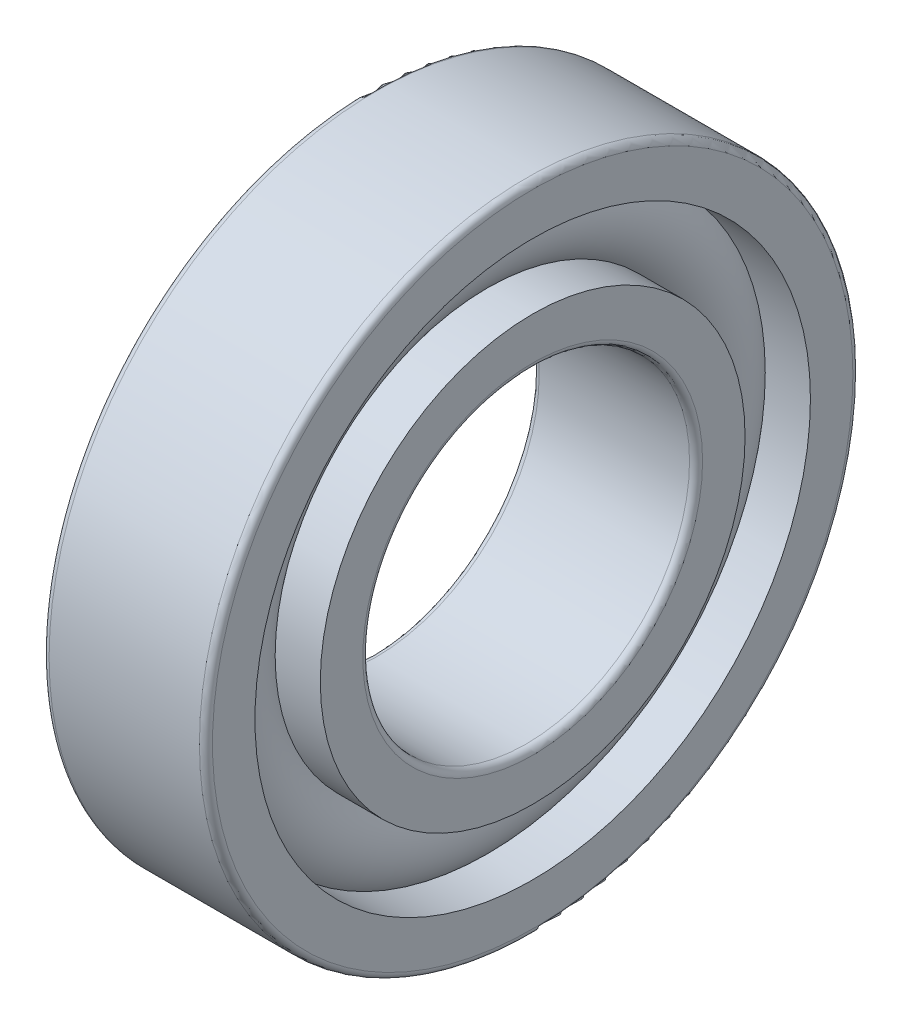
from build123d import *

# Parameters (mm, degrees)
CAGSPISKE_W     = 0.1905
CAGSPISKE_H     = 0.3175
CAGESPINE_ANGLE = 0.001
BALSIMSKE_R     = 0.9525


with BuildPart() as part:
    # CagSpiSke → CageSpine (revolve)
    with BuildSketch(Plane.XY):
        with Locations((0, 4.7625)):
            Rectangle(CAGSPISKE_W, CAGSPISKE_H)
    revolve(axis=Axis((-20.6375, 0, 0), (-1, 0, 0)), revolution_arc=CAGESPINE_ANGLE)

    # BalSimSke → BallsSimplified (revolve)
    with BuildSketch(Plane.XY):
        with Locations((0, 4.7625)):
            Circle(BALSIMSKE_R)
    revolve(axis=Axis((-10, 0, 0), (1, 0, 0)))

    # InnRacSke → InnerRace (revolve)
    with BuildSketch(Plane.XY):
        with BuildLine():
            Line((-0.650091976, 4.1275), (-1.5875, 4.1275))
            Line((-1.5875, 4.1275), (-1.5875, 3.302))
            ThreePointArc((-1.5875, 3.302), (-1.550302561, 3.212197439), (-1.4605, 3.175))
            Line((-1.4605, 3.175), (1.4605, 3.175))
            ThreePointArc((1.4605, 3.175), (1.550302561, 3.212197439), (1.5875, 3.302))
            Line((1.5875, 3.302), (1.5875, 4.1275))
            Line((1.5875, 4.1275), (0.700891976, 4.1275))
            ThreePointArc((0.700891976, 4.1275), (0.0254, 3.8354), (-0.650091976, 4.1275))
        make_face()
    revolve(axis=Axis((-20.6375, 0, 0), (1, 0, 0)))

    # OutRacSke → OuterRace (revolve)
    with BuildSketch(Plane.XY):
        with BuildLine():
            Line((-0.675491976, 5.3975), (-1.5875, 5.3975))
            Line((-1.5875, 5.3975), (-1.5875, 6.223))
            ThreePointArc((-1.5875, 6.223), (-1.550302561, 6.312802561), (-1.4605, 6.35))
            Line((-1.4605, 6.35), (1.4605, 6.35))
            ThreePointArc((1.4605, 6.35), (1.550302561, 6.312802561), (1.5875, 6.223))
            Line((1.5875, 6.223), (1.5875, 5.3975))
            Line((1.5875, 5.3975), (0.675491976, 5.3975))
            ThreePointArc((0.675491976, 5.3975), (0, 5.6896), (-0.675491976, 5.3975))
        make_face()
    revolve(axis=Axis((-20.6375, 0, 0), (1, 0, 0)))


solid = part.part
